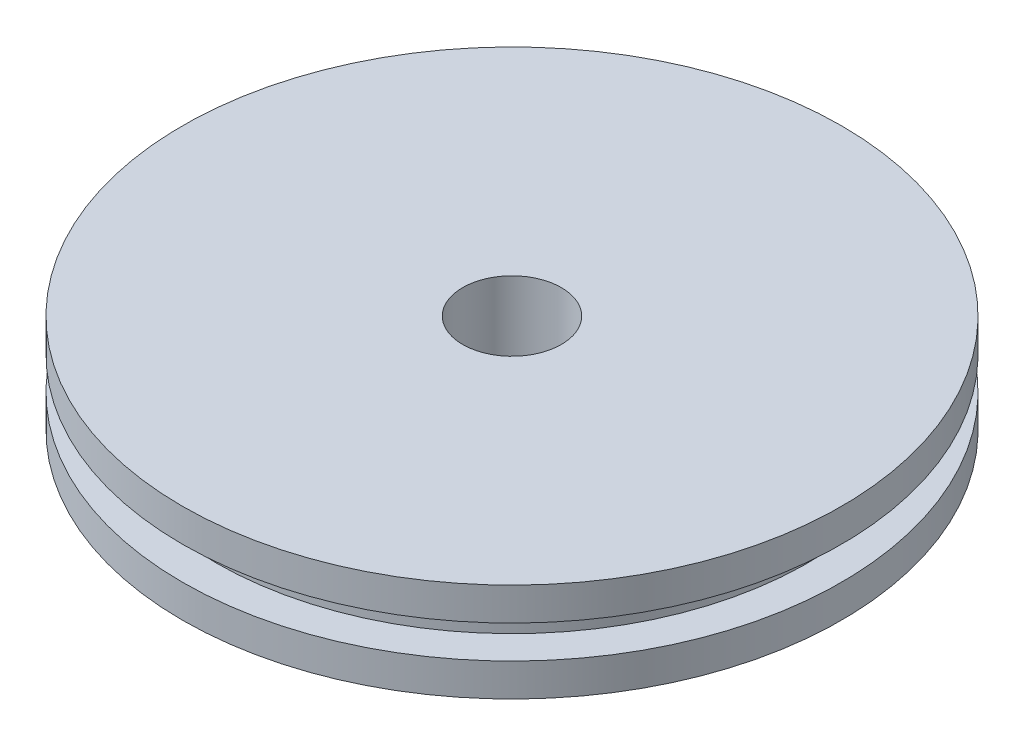
from build123d import *

# Parameters (mm, degrees)
SKETCH1_R           = 21.209
BOSS_EXTRUDE1_DEPTH = 2.116666667
SKETCH2_R           = 19.05
BOSS_EXTRUDE2_DEPTH = 2.116666667
SKETCH3_R           = 21.209
BOSS_EXTRUDE3_DEPTH = 2.116666667
SKETCH6_R           = 3.175
CUT_EXTRUDE2_DEPTH  = 31.658862699


with BuildPart() as part:
    # Sketch1 → Boss-Extrude1 (new body)
    with BuildSketch(Plane(origin=(0, 0, 0), x_dir=(1, 0, 0), z_dir=(0, 1, 0))):
        Circle(SKETCH1_R)
    extrude(amount=BOSS_EXTRUDE1_DEPTH)

    # Sketch2 → Boss-Extrude2 (add)
    with BuildSketch(Plane(origin=(0, 2.116666667, 0), x_dir=(1, 0, 0), z_dir=(0, 1, 0))):
        Circle(SKETCH2_R)
    extrude(amount=BOSS_EXTRUDE2_DEPTH)

    # Sketch3 → Boss-Extrude3 (add)
    with BuildSketch(Plane(origin=(0, 4.233333333, 0), x_dir=(1, 0, 0), z_dir=(0, 1, 0))):
        Circle(SKETCH3_R)
    extrude(amount=BOSS_EXTRUDE3_DEPTH)

    # Sketch6 → Cut-Extrude2 (cut, through all)
    with BuildSketch(Plane(origin=(0, 6.35, 0), x_dir=(1, 0, 0), z_dir=(0, 1, 0))):
        Circle(SKETCH6_R)
    extrude(amount=-CUT_EXTRUDE2_DEPTH, mode=Mode.SUBTRACT)


solid = part.part
